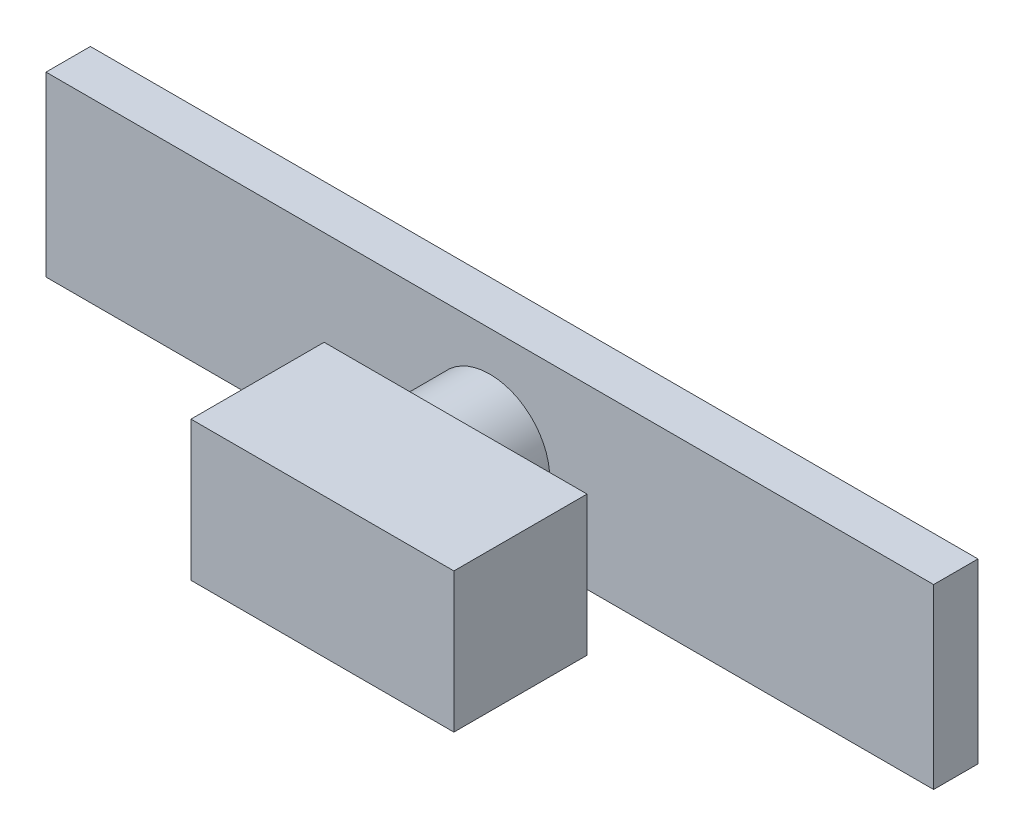
from build123d import *

# Parameters (mm, degrees)
SKETCH2_W           = 254
SKETCH2_H           = 12.7
BOSS_EXTRUDE1_DEPTH = 50.8
SKETCH3_R           = 17.140791438
BOSS_EXTRUDE2_DEPTH = 19.05
SKETCH4_W           = 75.235944222
SKETCH4_H           = 39.955088207
BOSS_EXTRUDE3_DEPTH = 38.1
SCALE2_SCALE        = 0.06
ROTATE_ANGLE        = 90
SCALE5_SCALE        = 0.25
SCALE6_SCALE        = 0.25


with BuildPart() as part:
    # Sketch2 → Boss-Extrude1 (new body)
    with BuildSketch(Plane.XY):
        with Locations((79.130769231, 14.898076923)):
            Rectangle(SKETCH2_W, SKETCH2_H)
    extrude(amount=BOSS_EXTRUDE1_DEPTH)

    # Sketch3 → Boss-Extrude2 (add)
    with BuildSketch(Plane(origin=(0, 21.248076923, 0), x_dir=(1, 0, 0), z_dir=(0, 1, 0))):
        with Locations((79.130769231, -28.483063876)):
            Circle(SKETCH3_R)
    extrude(amount=BOSS_EXTRUDE2_DEPTH)

    # Sketch4 → Boss-Extrude3 (add)
    with BuildSketch(Plane(origin=(0, 40.298076923, 0), x_dir=(1, 0, 0), z_dir=(0, 1, 0))):
        with Locations((88.38546847, -28.088530296)):
            Rectangle(SKETCH4_W, SKETCH4_H)
    extrude(amount=BOSS_EXTRUDE3_DEPTH)


with BuildPart() as part_1:
    # Scale2: scaled about (82.711857342, 33.041003565, 26.623476887)
    add(part.part.scale(SCALE2_SCALE).moved(Location((77.749145901, 31.058543351, 25.026068274))))


with BuildPart() as part_2:
    # rotate: moved
    add(part_1.part.rotate(Axis((0, 33.666927966, 26.550068274), (1, 0, 0)), ROTATE_ANGLE))


with BuildPart() as part_3:
    # Scale5: scaled about (82.711857342, 33.593519353, 25.924143873)
    add(part_2.part.scale(SCALE5_SCALE).moved(Location((62.033893007, 25.195139515, 19.443107905))))


with BuildPart() as part_4:
    # Move Body 4 x: moved
    add(part_3.part.moved(Location((-101.6, 0, 0))))


with BuildPart() as part_5:
    # Move Body 2 y: moved
    add(part_4.part.moved(Location((0, -55.88, 0))))


with BuildPart() as part_6:
    # Scale6: scaled about (-18.888142658, -22.286480647, 25.924143873)
    add(part_5.part.scale(SCALE6_SCALE).moved(Location((-14.166106993, -16.714860485, 19.443107905))))


with BuildPart() as part_7:
    # Move Body 2.1z: moved
    add(part_6.part.moved(Location((0, 0, -30.48))))


solid = part_7.part
